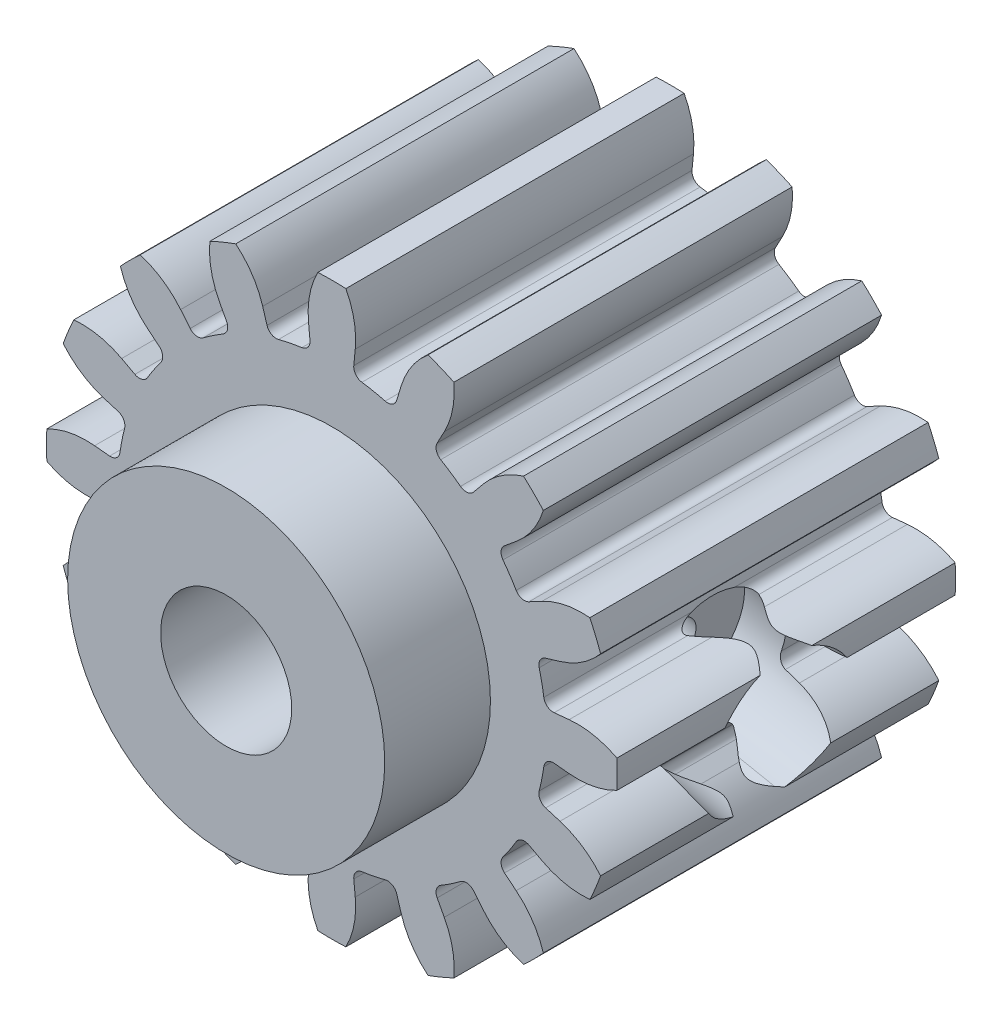
from build123d import *

# Parameters (mm, degrees)
MAINGEAR_DEPTH                     = 8
CONG_1_R                           = 0.45
R_P_TITION_CIRCULAIRE1_COUNT       = 16
CONG_1_OF_R_P_TITION_CIRCULAIRE1_R = 0.45
ESQUISSE9_R                        = 7.5
ESQUISSE9_R_2                      = 3.1
GEARBOTTOMFIX_DEPTH                = 5
ESQUISSE3_R                        = 3.1
GEARHOLE_DEPTH                     = 29.381331893
CUT_EXTRUDE2_DEPTH                 = 24.097618925
CUT_EXTRUDE2_DEPTH_BACK            = 24.097618925
SKETCH1_R                          = 1.25
SKETCH2_R                          = 3.5
CUT_EXTRUDE3_DEPTH                 = 30.269819976


with BuildPart() as part:
    # Esquisse1 → MainGear (new, symmetric)
    with BuildSketch(Plane.XY):
        with BuildLine():
            Line((0, 0), (9.930450964, 1.97528951))
            ThreePointArc((9.930450964, 1.97528951), (10.015412163, 1.485646054), (10.076245358, 0.992423546))
            Line((10.076245358, 0.992423546), (11.222012928, 1.105271802))
            ThreePointArc((11.222012928, 1.105271802), (12.385383401, 1.049862646), (13.483738659, 0.662413603))
            ThreePointArc((13.483738659, 0.662413603), (13.5, 0), (13.483738659, -0.662413603))
            ThreePointArc((13.483738659, -0.662413603), (12.385383401, -1.049862646), (11.222012928, -1.105271802))
            Line((11.222012928, -1.105271802), (10.076245358, -0.992423546))
            ThreePointArc((10.076245358, -0.992423546), (10.015412163, -1.485646054), (9.930450964, -1.97528951))
            Line((9.930450964, -1.97528951), (0, 0))
        make_face()
    maingear = extrude(amount=MAINGEAR_DEPTH, both=True)

    # Congé1
    cong_1_edges = [part.edges().sort_by_distance(p)[0] for p in [
        (10.076245358, -0.992423546, 0),
        (10.076245358, 0.992423546, 0),
    ]]
    fillet(cong_1_edges, radius=CONG_1_R)

    # Répétition circulaire1: MainGear ×16 about axis
    r_p_tition_circulaire1_axis = Axis((0, 0, 8), (0, 0, -1))
    for i in range(1, R_P_TITION_CIRCULAIRE1_COUNT):
        add(maingear.rotate(r_p_tition_circulaire1_axis, i * 360 / R_P_TITION_CIRCULAIRE1_COUNT))

    # Congé1 of Répétition circulaire1
    cong_1_of_r_p_tition_circulaire1_edges = [part.edges().sort_by_distance(p)[0] for p in [
        (8.929452802, -4.77289196, 0),
        (9.689020899, -2.939132357, 0),
        (6.423232002, -7.82673084, 0),
        (7.82673084, -6.423232002, 0),
        (2.939132357, -9.689020899, 0),
        (4.77289196, -8.929452802, 0),
        (-0.992423546, -10.076245358, 0),
        (0.992423546, -10.076245358, 0),
        (-4.77289196, -8.929452802, 0),
        (-2.939132357, -9.689020899, 0),
        (-7.82673084, -6.423232002, 0),
        (-6.423232002, -7.82673084, 0),
        (-9.689020899, -2.939132357, 0),
        (-8.929452802, -4.77289196, 0),
        (-10.076245358, 0.992423546, 0),
        (-10.076245358, -0.992423546, 0),
        (-8.929452802, 4.77289196, 0),
        (-9.689020899, 2.939132357, 0),
        (-6.423232002, 7.82673084, 0),
        (-7.82673084, 6.423232002, 0),
        (-2.939132357, 9.689020899, 0),
        (-4.77289196, 8.929452802, 0),
        (0.992423546, 10.076245358, 0),
        (-0.992423546, 10.076245358, 0),
        (4.77289196, 8.929452802, 0),
        (2.939132357, 9.689020899, 0),
        (7.82673084, 6.423232002, 0),
        (6.423232002, 7.82673084, 0),
        (9.689020899, 2.939132357, 0),
        (8.929452802, 4.77289196, 0),
    ]]
    fillet(cong_1_of_r_p_tition_circulaire1_edges, radius=CONG_1_OF_R_P_TITION_CIRCULAIRE1_R)

    # Esquisse9 → GearBottomFix (add)
    with BuildSketch(Plane.XY.offset(8)):
        Circle(ESQUISSE9_R)
        Circle(ESQUISSE9_R_2, mode=Mode.SUBTRACT)
    extrude(amount=GEARBOTTOMFIX_DEPTH)

    # Esquisse3 → GearHole (cut, through all)
    with BuildSketch(Plane.XY.offset(-8)):
        Circle(ESQUISSE3_R)
    extrude(amount=GEARHOLE_DEPTH, mode=Mode.SUBTRACT)

    # Sketch1 → Cut-Extrude2 (cut, two sides: drawn at the far end of the back side and taken through both)
    with BuildSketch(Plane(origin=(0, 0, 0), x_dir=(0, 0, -1), z_dir=(0.9807852804032304, -0.19509032201612872, 0)).offset(-CUT_EXTRUDE2_DEPTH_BACK)):
        Circle(SKETCH1_R)
    extrude(amount=CUT_EXTRUDE2_DEPTH + CUT_EXTRUDE2_DEPTH_BACK, mode=Mode.SUBTRACT)

    # Sketch2 → Cut-Extrude3 (cut, through all)
    with BuildSketch(Plane(origin=(7.953530242, -1.582055529, 0), x_dir=(0, 0, -1), z_dir=(0.9807852804032303, -0.19509032201612866, 0))):
        Circle(SKETCH2_R)
    extrude(amount=CUT_EXTRUDE3_DEPTH, mode=Mode.SUBTRACT)


solid = part.part
